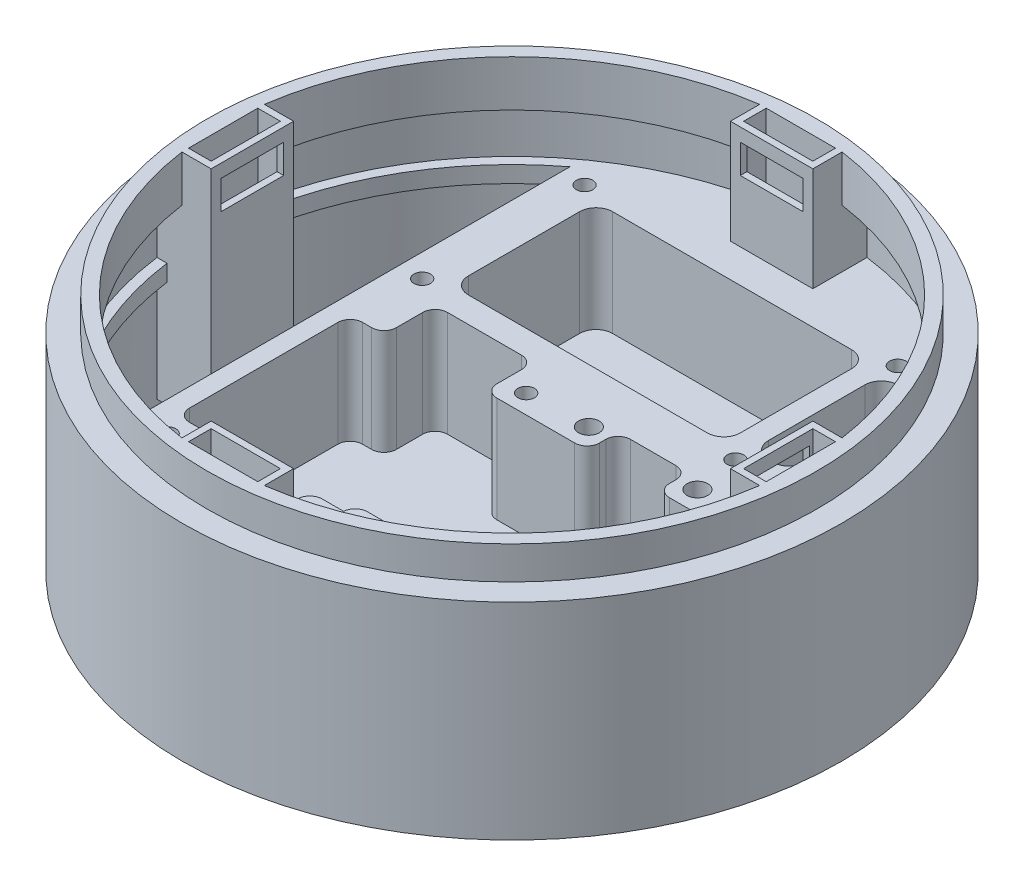
from build123d import *
from build123d.topology import SkipClean

# Parameters (mm, degrees)
SKETCH1_R                 = 40
BOSS_EXTRUDE1_DEPTH       = 25
SKETCH2_R                 = 37
BOSS_EXTRUDE2_DEPTH       = 4
SHELL1_T                  = -1.6
CUT_EXTRUDE2_START        = -5.6
SKETCH4_R                 = 35.4
CUT_EXTRUDE2_DEPTH        = 5.6
BOSS_EXTRUDE3_START       = 2
SKETCH5_R                 = 38.4
BOSS_EXTRUDE3_DEPTH       = 2
SKETCH6_R                 = 1.25
CUT_EXTRUDE3_DEPTH        = 2
SKETCH8_R                 = 1
CUT_EXTRUDE4_DEPTH        = 2
SKETCH9_R                 = 1
SKETCH9_W                 = 33
SKETCH9_H                 = 17.5
CUT_EXTRUDE5_DEPTH        = 2
FILLET4_R                 = 2
CUT_EXTRUDE6_DEPTH        = 2
BOSS_EXTRUDE4_START       = -6.9
BOSS_EXTRUDE4_OUTLINE_W   = 10
BOSS_EXTRUDE4_OUTLINE_H   = 14.4
BOSS_EXTRUDE4_OUTLINE_H_2 = 7
BOSS_EXTRUDE4_DEPTH       = 6.9
BOSS_EXTRUDE4_START_2     = -4.027089231
BOSS_EXTRUDE4_2_OUTLINE_W = 10
BOSS_EXTRUDE4_2_OUTLINE_H = 5.6
BOSS_EXTRUDE4_2_DEPTH     = 4.027089231
SKETCH13_W                = 8.4
SKETCH13_H                = 2.745113782
CUT_EXTRUDE7_DEPTH        = 29
CIRPATTERN3_START         = 14.4
CIRPATTERN3_OUTLINE_W     = 8.4
CIRPATTERN3_OUTLINE_H     = 2.745113782
CIRPATTERN3_DEPTH         = 2
CIRPATTERN3_2_OUTLINE_W   = 8.4
CIRPATTERN3_2_OUTLINE_H   = 2.745113782
CIRPATTERN3_2_OUTLINE_W_2 = 2.745113782
CIRPATTERN3_2_OUTLINE_H_2 = 8.4
CIRPATTERN3_2_DEPTH       = 23.991472
CIRPATTERN3_START_2       = 23.4
CIRPATTERN3_3_OUTLINE_W   = 8.4
CIRPATTERN3_3_OUTLINE_H   = 2.745113782
CIRPATTERN3_3_OUTLINE_W_2 = 2.745113782
CIRPATTERN3_3_OUTLINE_H_2 = 8.4
CIRPATTERN3_3_DEPTH       = 5.6
BOSS_EXTRUDE5_START       = 12.9
BOSS_EXTRUDE5_DEPTH       = 12.9
CUT_EXTRUDE12_DEPTH       = 1.5
CUT_EXTRUDE9_DEPTH        = 1.5
CUT_EXTRUDE14_START       = 1.5
SKETCH22_R                = 38.4
CUT_EXTRUDE14_DEPTH       = 1.5
SKETCH23_R                = 1.25
SKETCH23_R_2              = 1
CUT_EXTRUDE15_DEPTH       = 10.8
CUT_EXTRUDE10_REACH       = 88.909
SKETCH14_W                = 7.6
SKETCH14_H                = 3.5
CUT_EXTRUDE11_REACH       = 88.909
SKETCH18_W                = 7.6
SKETCH18_H                = 3.5
SKETCH24_W                = 34.5
SKETCH24_H                = 44
BOSS_EXTRUDE6_DEPTH       = 0.75
CHAMFER1_SIZE             = 0.75
CUT_EXTRUDE20_START       = -14.9
CUT_EXTRUDE20_DEPTH       = 14.9
CUT_EXTRUDE21_DEPTH       = 12.8
SKETCH33_W                = 19.8
SKETCH33_H                = 12.8
CUT_EXTRUDE22_DEPTH       = 28.191583709
FILLET6_R                 = 1.5


with BuildPart() as part:
    # Sketch1 → Boss-Extrude1 (new body)
    with BuildSketch(Plane(origin=(0, 0, 0), x_dir=(1, 0, 0), z_dir=(0, 1, 0))):
        with Locations(Location((0, 0, 0), (0, 0, 270))):
            Circle(SKETCH1_R)
    extrude(amount=BOSS_EXTRUDE1_DEPTH)

    # Sketch2 → Boss-Extrude2 (add)
    with BuildSketch(Plane(origin=(0, 25, 0), x_dir=(1, 0, 0), z_dir=(0, 1, 0))):
        with Locations(Location((0, 0, 0), (0, 0, 270))):
            Circle(SKETCH2_R)
    extrude(amount=BOSS_EXTRUDE2_DEPTH)

    # Shell1
    shell1_openings = [part.faces().sort_by_distance(p)[0] for p in [
        (0, 0, 0),
    ]]
    offset(amount=SHELL1_T, openings=shell1_openings, kind=Kind.INTERSECTION)

    # Sketch4 → Cut-Extrude2 (cut)
    with BuildSketch(Plane(origin=(0, 29, 0), x_dir=(1, 0, 0), z_dir=(0, 1, 0)).offset(CUT_EXTRUDE2_START)):
        with Locations(Location((0, 0, 0), (0, 0, 270))):
            Circle(SKETCH4_R)
    extrude(amount=CUT_EXTRUDE2_DEPTH, mode=Mode.SUBTRACT)

    # Sketch5 → Boss-Extrude3 (add)
    with BuildSketch(Plane(origin=(0, 16.4, 0), x_dir=(-1, 0, 0), z_dir=(0, -1, 0)).offset(BOSS_EXTRUDE3_START)):
        with Locations(Location((0, 0, 0), (0, 0, 90))):
            Circle(SKETCH5_R)
    extrude(amount=-BOSS_EXTRUDE3_DEPTH)

    # Sketch6 → Cut-Extrude3 (cut)
    with BuildSketch(Plane(origin=(0, 16.4, 0), x_dir=(1, 0, 0), z_dir=(0, 1, 0))):
        with Locations(Location((19.09668222, 3.4, 0), (0, 0, 270))):
            Circle(SKETCH6_R)
        with Locations(Location((5.92668222, 3.4, 0), (0, 0, 270))):
            Circle(SKETCH6_R)
        with Locations(Location((20.76668222, -27.4, 0), (0, 0, 270))):
            Circle(SKETCH6_R)
        with Locations(Location((4.25668222, -27.4, 0), (0, 0, 270))):
            Circle(SKETCH6_R)
        Polygon((8.26168222, 0.85), (1.81168222, 0.85), (1.81168222, -18.95), (8.26168222, -18.95), (8.26168222, -28.750015402), (16.76168222, -28.750015402), (16.76168222, -18.95), (23.21168222, -18.95), (23.21168222, 0.85), (16.76168222, 0.85), (16.76168222, 4.615440546), (8.26168222, 4.615440546), align=None)
    extrude(amount=-CUT_EXTRUDE3_DEPTH, mode=Mode.SUBTRACT)

    # Sketch8 → Cut-Extrude4 (cut)
    with BuildSketch(Plane(origin=(0, 16.4, 0), x_dir=(1, 0, 0), z_dir=(0, 1, 0))):
        with Locations(Location((-1.429901488, -22.85, 0), (0, 0, 270))):
            Circle(SKETCH8_R)
        with Locations(Location((-18.929901488, -22.85, 0), (0, 0, 270))):
            Circle(SKETCH8_R)
        with Locations(Location((-1.429901488, 3.15, 0), (0, 0, 270))):
            Circle(SKETCH8_R)
        Polygon((-16.179901488, -24.35), (-16.179901488, -20.35), (-20.279901488, -20.35), (-20.279901488, 0.65), (-16.179901488, 0.65), (-16.179901488, 6.85), (-4.179901488, 6.85), (-4.179901488, 0.65), (-0.079901488, 0.65), (-0.079901488, -20.35), (-4.179901488, -20.35), (-4.179901488, -24.35), align=None)
    extrude(amount=-CUT_EXTRUDE4_DEPTH, mode=Mode.SUBTRACT)

    # Sketch9 → Cut-Extrude5 (cut)
    with BuildSketch(Plane(origin=(0, 16.4, 0), x_dir=(1, 0, 0), z_dir=(0, 1, 0))):
        with Locations(Location((18.25, 28.55, 0), (0, 0, 270))):
            Circle(SKETCH9_R)
        with Locations(Location((-19.75, 28.55, 0), (0, 0, 90))):
            Circle(SKETCH9_R)
        with Locations(Location((18.25, 8.85, 0), (0, 0, 90))):
            Circle(SKETCH9_R)
        with Locations(Location((-19.75, 8.85, 0), (0, 0, 270))):
            Circle(SKETCH9_R)
        with Locations((-0.75, 18.7)):
            Rectangle(SKETCH9_W, SKETCH9_H)
    extrude(amount=-CUT_EXTRUDE5_DEPTH, mode=Mode.SUBTRACT)

    # Fillet4
    fillet4_edges = [part.edges().sort_by_distance(p)[0] for p in [
        (-17.25, 15.4, -9.95),
        (15.75, 15.4, -9.95),
        (15.75, 15.4, -27.45),
        (-17.25, 15.4, -27.45),
    ]]
    fillet(fillet4_edges, radius=FILLET4_R)

    # Sketch11 → Cut-Extrude6 (cut)
    with BuildSketch(Plane(origin=(0, 16.4, 0), x_dir=(1, 0, 0), z_dir=(0, 1, 0))):
        with BuildLine():
            Line((24.01168222, -28.412657689), (24.01168222, 28.412657689))
            ThreePointArc((24.01168222, 28.412657689), (37.2, 0), (24.01168222, -28.412657689))
        make_face()
        with BuildLine():
            Line((-22.55, -29.586103157), (-22.55, 29.586103157))
            ThreePointArc((-22.55, 29.586103157), (-37.2, 0), (-22.55, -29.586103157))
        make_face()
    extrude(amount=-CUT_EXTRUDE6_DEPTH, mode=Mode.SUBTRACT)

    # Boss-Extrude4: read off the stored shape, not the designer's step
    # Boss-Extrude4 outline → Boss-Extrude4 (add)
    with BuildSketch(Plane.XY.offset(-31.5).offset(BOSS_EXTRUDE4_START)):
        with Locations((0, 7.2)):
            Rectangle(BOSS_EXTRUDE4_OUTLINE_W, BOSS_EXTRUDE4_OUTLINE_H)
        with Locations((0, 19.9)):
            Rectangle(BOSS_EXTRUDE4_OUTLINE_W, BOSS_EXTRUDE4_OUTLINE_H_2)
    extrude(amount=BOSS_EXTRUDE4_DEPTH)

    # Boss-Extrude4 2 outline → Boss-Extrude4 2 (add)
    with BuildSketch(Plane.XY.offset(-31.5).offset(BOSS_EXTRUDE4_START_2)):
        with Locations((0, 26.2)):
            Rectangle(BOSS_EXTRUDE4_2_OUTLINE_W, BOSS_EXTRUDE4_2_OUTLINE_H)
    extrude(amount=BOSS_EXTRUDE4_2_DEPTH)

    # Sketch13 → Cut-Extrude7 (cut)
    with BuildSketch(Plane(origin=(0, 29, 0), x_dir=(1, 0, 0), z_dir=(0, 1, 0))):
        with Locations((0, 33.672556891)):
            Rectangle(SKETCH13_W, SKETCH13_H)
    extrude(amount=-CUT_EXTRUDE7_DEPTH, mode=Mode.SUBTRACT)

    # CirPattern3: read off the stored shape, not the designer's step
    # CirPattern3 outline → CirPattern3 (cut)
    with BuildSketch(Plane(origin=(0, 0, 0), x_dir=(1, 0, 0), z_dir=(0, 1, 0)).offset(CIRPATTERN3_START)):
        with Locations((0, -33.672556891)):
            Rectangle(CIRPATTERN3_OUTLINE_W, CIRPATTERN3_OUTLINE_H)
    extrude(amount=CIRPATTERN3_DEPTH, mode=Mode.SUBTRACT)

    # CirPattern3 2 outline → CirPattern3 2 (add)
    # profile 1 of 3: a face of its own
    with BuildSketch(Plane(origin=(0, 0, 0), x_dir=(1, 0, 0), z_dir=(0, 1, 0))):
        with BuildLine():
            Line((5, -31.5), (-5, -31.5))
            Line((-5, -31.5), (-5, -38.073087608))
            ThreePointArc((-5, -38.073087608), (0, -38.4), (5, -38.073087608))
            Line((5, -38.073087608), (5, -31.5))
        make_face()
        with Locations((0, -33.672556891)):
            Rectangle(CIRPATTERN3_2_OUTLINE_W, CIRPATTERN3_2_OUTLINE_H, mode=Mode.SUBTRACT)
    # profile 2 of 3: a face of its own
    with BuildSketch(Plane(origin=(0, 0, 0), x_dir=(1, 0, 0), z_dir=(0, 1, 0))):
        with BuildLine():
            Line((-31.5, 5), (-38.073087608, 5))
            ThreePointArc((-38.073087608, 5), (-38.4, 0), (-38.073087608, -5))
            Line((-38.073087608, -5), (-31.5, -5))
            Line((-31.5, -5), (-31.5, 5))
        make_face()
        with Locations((-33.672556891, 0)):
            Rectangle(CIRPATTERN3_2_OUTLINE_W_2, CIRPATTERN3_2_OUTLINE_H_2, mode=Mode.SUBTRACT)
    # profile 3 of 3: a face of its own
    with BuildSketch(Plane(origin=(0, 0, 0), x_dir=(1, 0, 0), z_dir=(0, 1, 0))):
        with BuildLine():
            Line((31.5, 5), (31.5, -5))
            Line((31.5, -5), (38.073087608, -5))
            ThreePointArc((38.073087608, -5), (38.4, 0), (38.073087608, 5))
            Line((38.073087608, 5), (31.5, 5))
        make_face()
        with Locations((33.672556891, 0)):
            Rectangle(CIRPATTERN3_2_OUTLINE_W_2, CIRPATTERN3_2_OUTLINE_H_2, mode=Mode.SUBTRACT)
    extrude(amount=CIRPATTERN3_2_DEPTH)

    # CirPattern3 3 outline → CirPattern3 3 (add)
    # profile 1 of 3: a face of its own
    with BuildSketch(Plane(origin=(0, 0, 0), x_dir=(1, 0, 0), z_dir=(0, 1, 0)).offset(CIRPATTERN3_START_2)):
        with BuildLine():
            Line((5, -31.5), (-5, -31.5))
            Line((-5, -31.5), (-5, -35.045113782))
            ThreePointArc((-5, -35.045113782), (0, -35.4), (5, -35.045113782))
            Line((5, -35.045113782), (5, -31.5))
        make_face()
        with Locations((0, -33.672556891)):
            Rectangle(CIRPATTERN3_3_OUTLINE_W, CIRPATTERN3_3_OUTLINE_H, mode=Mode.SUBTRACT)
    # profile 2 of 3: a face of its own
    with BuildSketch(Plane(origin=(0, 0, 0), x_dir=(1, 0, 0), z_dir=(0, 1, 0)).offset(CIRPATTERN3_START_2)):
        with BuildLine():
            ThreePointArc((-35.045113782, 5), (-35.4, 0), (-35.045113782, -5))
            Line((-35.045113782, -5), (-31.5, -5))
            Line((-31.5, -5), (-31.5, 5))
            Line((-31.5, 5), (-35.045113782, 5))
        make_face()
        with Locations((-33.672556891, 0)):
            Rectangle(CIRPATTERN3_3_OUTLINE_W_2, CIRPATTERN3_3_OUTLINE_H_2, mode=Mode.SUBTRACT)
    # profile 3 of 3: a face of its own
    with BuildSketch(Plane(origin=(0, 0, 0), x_dir=(1, 0, 0), z_dir=(0, 1, 0)).offset(CIRPATTERN3_START_2)):
        with BuildLine():
            Line((31.5, -5), (35.045113782, -5))
            ThreePointArc((35.045113782, -5), (35.4, 0), (35.045113782, 5))
            Line((35.045113782, 5), (31.5, 5))
            Line((31.5, 5), (31.5, -5))
        make_face()
        with Locations((33.672556891, 0)):
            Rectangle(CIRPATTERN3_3_OUTLINE_W_2, CIRPATTERN3_3_OUTLINE_H_2, mode=Mode.SUBTRACT)
    extrude(amount=CIRPATTERN3_3_DEPTH)

    # Sketch16 → Boss-Extrude5 (add)
    with BuildSketch(Plane.XZ.offset(-14.4).offset(BOSS_EXTRUDE5_START)):
        with BuildLine():
            Line((-5, -38.073087608), (-5, -31.5))
            Line((-5, -31.5), (5, -31.5))
            Line((5, -31.5), (5, -38.073087608))
            ThreePointArc((5, -38.073087608), (15.061476564, -35.322965953), (24.01168222, -29.966633394))
            Line((24.01168222, -29.966633394), (24.01168222, 29.966633394))
            ThreePointArc((24.01168222, 29.966633394), (15.061476564, 35.322965953), (5, 38.073087608))
            Line((5, 38.073087608), (5, 31.5))
            Line((5, 31.5), (-5, 31.5))
            Line((-5, 31.5), (-5, 38.073087608))
            ThreePointArc((-5, 38.073087608), (-14.211661402, 35.673360932), (-22.55, 31.081465538))
            Line((-22.55, 31.081465538), (-22.55, -31.081465538))
            ThreePointArc((-22.55, -31.081465538), (-14.211661402, -35.673360932), (-5, -38.073087608))
        make_face()
    extrude(amount=-BOSS_EXTRUDE5_DEPTH)

    # Sketch19 → Cut-Extrude12 (cut)
    with BuildSketch(Plane.XZ):
        with BuildLine():
            Line((5, 38.073087608), (5, 31.5))
            Line((5, 31.5), (-5, 31.5))
            Line((-5, 31.5), (-5, 38.073087608))
            ThreePointArc((-5, 38.073087608), (0, 38.4), (5, 38.073087608))
        make_face()
    extrude(amount=-CUT_EXTRUDE12_DEPTH, mode=Mode.SUBTRACT)

    # Sketch15 → Cut-Extrude9 (cut)
    with BuildSketch(Plane(origin=(0, 1.5, 0), x_dir=(-1, 0, 0), z_dir=(0, -1, 0))):
        with BuildLine():
            Line((-17.25, 25.192602838), (-17.25, -34.307397162))
            ThreePointArc((-17.25, -34.307397162), (0, -38.4), (17.25, -34.307397162))
            Line((17.25, -34.307397162), (17.25, 25.192602838))
            Line((17.25, 25.192602838), (-17.25, 25.192602838))
        make_face()
    extrude(amount=-CUT_EXTRUDE9_DEPTH, mode=Mode.SUBTRACT)

    # Sketch22 → Cut-Extrude14 (cut)
    with SkipClean():  # the faces are left unmerged after this step: merging them gives an invalid solid
        with BuildSketch(Plane(origin=(0, 1.5, 0), x_dir=(-1, 0, 0), z_dir=(0, -1, 0)).offset(CUT_EXTRUDE14_START)):
            with Locations(Location((0, 0, 0), (0, 0, 54.038635621))):
                Circle(SKETCH22_R)
        extrude(amount=-CUT_EXTRUDE14_DEPTH, mode=Mode.SUBTRACT)
    add(part.part.scale(1), mode=Mode.REPLACE)  # the faces are merged on a copy

    # Sketch23 → Cut-Extrude15 (cut)
    with BuildSketch(Plane(origin=(0, 14.4, 0), x_dir=(1, 0, 0), z_dir=(0, 1, 0))):
        with Locations(Location((5.92668222, 3.4, 0), (0, 0, 270))):
            Circle(SKETCH23_R)
        with Locations(Location((-19.75, 8.85, 0), (0, 0, 270))):
            Circle(SKETCH23_R_2)
        with Locations(Location((-19.75, 28.55, 0), (0, 0, 90))):
            Circle(SKETCH23_R_2)
        with Locations(Location((18.25, 28.55, 0), (0, 0, 270))):
            Circle(SKETCH23_R_2)
        with Locations(Location((18.25, 8.85, 0), (0, 0, 90))):
            Circle(SKETCH23_R_2)
        with Locations(Location((-1.429901488, 3.15, 0), (0, 0, 270))):
            Circle(SKETCH23_R_2)
        with Locations(Location((19.09668222, 3.4, 0), (0, 0, 270))):
            Circle(SKETCH23_R)
        with Locations(Location((-18.929901488, -22.85, 0), (0, 0, 270))):
            Circle(SKETCH23_R_2)
        with Locations(Location((-1.429901488, -22.85, 0), (0, 0, 270))):
            Circle(SKETCH23_R_2)
        with Locations(Location((20.76668222, -27.4, 0), (0, 0, 270))):
            Circle(SKETCH23_R)
        with Locations(Location((4.25668222, -27.4, 0), (0, 0, 270))):
            Circle(SKETCH23_R)
        Polygon((23.21168222, 0.85), (16.76168222, 0.85), (16.76168222, 4.615440546), (8.26168222, 4.615440546), (8.26168222, 0.85), (1.81168222, 0.85), (1.81168222, -18.95), (8.26168222, -18.95), (8.26168222, -28.750015402), (16.76168222, -28.750015402), (16.76168222, -18.95), (23.21168222, -18.95), align=None)
        Polygon((-16.179901488, 0.65), (-20.279901488, 0.65), (-20.279901488, -20.35), (-16.179901488, -20.35), (-16.179901488, -24.35), (-4.179901488, -24.35), (-4.179901488, -20.35), (-0.079901488, -20.35), (-0.079901488, 0.65), (-4.179901488, 0.65), (-4.179901488, 6.85), (-16.179901488, 6.85), align=None)
        with BuildLine():
            Line((13.75, 27.45), (-15.25, 27.45))
            ThreePointArc((-15.25, 27.45), (-16.664213562, 26.864213562), (-17.25, 25.45))
            Line((-17.25, 25.45), (-17.25, 11.95))
            ThreePointArc((-17.25, 11.95), (-16.664213562, 10.535786438), (-15.25, 9.95))
            Line((-15.25, 9.95), (13.75, 9.95))
            ThreePointArc((13.75, 9.95), (15.164213562, 10.535786438), (15.75, 11.95))
            Line((15.75, 11.95), (15.75, 25.45))
            ThreePointArc((15.75, 25.45), (15.164213562, 26.864213562), (13.75, 27.45))
        make_face()
    extrude(amount=-CUT_EXTRUDE15_DEPTH, mode=Mode.SUBTRACT)

    # Sketch14 → Cut-Extrude10 (cut, up to next)
    with BuildSketch(Plane.XY.offset(-31.5), mode=Mode.PRIVATE) as cut_extrude10_sk1:
        with Locations((0, 25.65)):
            Rectangle(SKETCH14_W, SKETCH14_H)
    cut_extrude10_tool1 = extrude(cut_extrude10_sk1.sketch, amount=-CUT_EXTRUDE10_REACH, mode=Mode.PRIVATE) & part.part
    add(cut_extrude10_tool1.solids().sort_by_distance((0, 25.65, -31.5))[0], mode=Mode.SUBTRACT)

    # Sketch18 → Cut-Extrude11 (cut, up to next)
    with BuildSketch(Plane(origin=(31.5, 0, 0), x_dir=(0, 0, -1), z_dir=(1, 0, 0)), mode=Mode.PRIVATE) as cut_extrude11_sk1:
        with Locations((0, 25.65)):
            Rectangle(SKETCH18_W, SKETCH18_H)
    cut_extrude11_tool1 = extrude(cut_extrude11_sk1.sketch, amount=CUT_EXTRUDE11_REACH, mode=Mode.PRIVATE) & part.part
    cut_extrude11 = cut_extrude11_tool1.solids().sort_by_distance((31.5, 25.65, 0))[0]
    add(cut_extrude11, mode=Mode.SUBTRACT)

    # Mirror3: Cut-Extrude11 across plane
    add(cut_extrude11.mirror(Plane(origin=(0, 0, 0), x_dir=(0, 0, 1), z_dir=(1, 0, 0))), mode=Mode.SUBTRACT)

    # Sketch24 → Boss-Extrude6 (add)
    with BuildSketch(Plane.XZ.offset(-3)):
        with Locations((0, -3.192602838)):
            Rectangle(SKETCH24_W, SKETCH24_H)
    extrude(amount=BOSS_EXTRUDE6_DEPTH)

    # Chamfer1
    chamfer1_edges = [part.edges().sort_by_distance(p)[0] for p in [
        (0, 2.25, 18.807397162),
    ]]
    chamfer(chamfer1_edges, length=CHAMFER1_SIZE - 0.0001)  # a hair under: the kernel refuses the full size

    # Sketch30 → Cut-Extrude20 (cut)
    with BuildSketch(Plane(origin=(0, 16.4, 0), x_dir=(1, 0, 0), z_dir=(0, 1, 0)).offset(CUT_EXTRUDE20_START)):
        with BuildLine():
            Line((0.920098512, -32.15), (17.25, -32.15))
            Line((17.25, -32.15), (17.25, -34.307397162))
            ThreePointArc((17.25, -34.307397162), (0, -38.4), (-17.25, -34.307397162))
            Line((-17.25, -34.307397162), (-17.25, -32.15))
            Line((-17.25, -32.15), (0.920098512, -32.15))
        make_face()
    extrude(amount=CUT_EXTRUDE20_DEPTH, mode=Mode.SUBTRACT)

    # Sketch31 → Cut-Extrude21 (cut)
    with SkipClean():  # the faces are left unmerged after this step: merging them gives an invalid solid
        with BuildSketch(Plane(origin=(0, 16.4, 0), x_dir=(1, 0, 0), z_dir=(0, 1, 0))):
            with BuildLine():
                Line((20.81168222, 10.85), (20.25, 10.85))
                ThreePointArc((20.25, 10.85), (18.835786438, 11.435786438), (18.25, 12.85))
                Line((18.25, 12.85), (18.25, 24.55))
                ThreePointArc((18.25, 24.55), (18.835786438, 25.964213562), (20.25, 26.55))
                Line((20.25, 26.55), (20.81168222, 26.55))
                ThreePointArc((20.81168222, 26.55), (22.225895783, 25.964213562), (22.81168222, 24.55))
                Line((22.81168222, 24.55), (22.81168222, 12.85))
                ThreePointArc((22.81168222, 12.85), (22.225895783, 11.435786438), (20.81168222, 10.85))
            make_face()
        extrude(amount=-CUT_EXTRUDE21_DEPTH, mode=Mode.SUBTRACT)

    # Sketch33 → Cut-Extrude22 (cut)
    with SkipClean():  # the faces are left unmerged after this step: merging them gives an invalid solid
        with BuildSketch(Plane(origin=(24.01168222, 0, 0), x_dir=(0, 0, -1), z_dir=(1, 0, 0))):
            with Locations((-9.05, 10)):
                Rectangle(SKETCH33_W, SKETCH33_H)
        extrude(amount=-CUT_EXTRUDE22_DEPTH, mode=Mode.SUBTRACT)

    # Fillet6
    # the kernel refuses this fillet: 1.5 mm, written as the material it adds along each edge
    with BuildSketch(Plane(origin=(-4.179901488, 3.6, -6.85), x_dir=(-1, 0, 0), z_dir=(0, 1, 0)), Plane(origin=(-16.179901488, 3.6, -6.85), x_dir=(0, 0, 1), z_dir=(0, 1, 0)), Plane(origin=(-20.279901488, 3.6, -0.65), x_dir=(0, 0, 1), z_dir=(0, 1, 0)), Plane(origin=(-20.279901488, 3.6, 20.35), x_dir=(1, 0, 0), z_dir=(0, 1, 0)), Plane(origin=(16.76168222, 3.6, -4.615440546), x_dir=(-1, 0, 0), z_dir=(0, 1, 0)), Plane(origin=(8.26168222, 3.6, -4.615440546), x_dir=(0, 0, 1), z_dir=(0, 1, 0))) as fillet6_piece_1:
        with BuildLine():
            CenterArc((FILLET6_R, FILLET6_R), FILLET6_R, 180, 90)
            Line((0, FILLET6_R), (0, 0))
            Line((0, 0), (FILLET6_R, 0))
        make_face()
    extrude(amount=12.8)
    with BuildSketch(Plane(origin=(-16.179901488, 16.4, 24.35), x_dir=(1, 0, 0), z_dir=(0, -1, 0)), Plane(origin=(-4.179901488, 16.4, 24.35), x_dir=(0, 0, -1), z_dir=(0, -1, 0)), Plane(origin=(8.26168222, 16.4, 28.750015402), x_dir=(1, 0, 0), z_dir=(0, -1, 0)), Plane(origin=(16.76168222, 16.4, 28.750015402), x_dir=(0, 0, -1), z_dir=(0, -1, 0))) as fillet6_piece_2:
        with BuildLine():
            CenterArc((FILLET6_R, -FILLET6_R), FILLET6_R, 90, 90)
            Line((0, -FILLET6_R), (0, 0))
            Line((0, 0), (FILLET6_R, 0))
        make_face()
    extrude(amount=12.8)
    # the kernel refuses this fillet: 1.5 mm, written as the material it takes off along each edge
    with BuildSketch(Plane(origin=(-4.179901488, 20.15, 20.35), x_dir=(1, 0, 0), z_dir=(0, -1, 0)), Plane(origin=(8.26168222, 20.15, -0.85), x_dir=(-1, 0, 0), z_dir=(0, -1, 0)), Plane(origin=(8.26168222, 20.15, 18.95), x_dir=(0, 0, 1), z_dir=(0, -1, 0))) as fillet6_2_piece_1:
        with BuildLine():
            CenterArc((FILLET6_R, FILLET6_R), FILLET6_R, 180, 90)
            Line((0, FILLET6_R), (0, 0))
            Line((0, 0), (FILLET6_R, 0))
        make_face()
    extrude(amount=16.55, mode=Mode.SUBTRACT)
    with BuildSketch(Plane(origin=(-16.179901488, 3.6, -0.65), x_dir=(-1, 0, 0), z_dir=(0, 1, 0)), Plane(origin=(-16.179901488, 3.6, 20.35), x_dir=(0, 0, 1), z_dir=(0, 1, 0)), Plane(origin=(16.76168222, 3.6, -0.85), x_dir=(0, 0, -1), z_dir=(0, 1, 0)), Plane(origin=(16.76168222, 3.6, 18.95), x_dir=(1, 0, 0), z_dir=(0, 1, 0))) as fillet6_2_piece_2:
        with BuildLine():
            CenterArc((FILLET6_R, -FILLET6_R), FILLET6_R, 90, 90)
            Line((0, -FILLET6_R), (0, 0))
            Line((0, 0), (FILLET6_R, 0))
        make_face()
    extrude(amount=16.55, mode=Mode.SUBTRACT)
    with BuildSketch(Plane(origin=(-4.179901489, 3.6, -0.85), x_dir=(2.337176378356769e-10, 0, -1.0), z_dir=(0, 1, 0))) as fillet6_2_piece_3:
        with BuildLine():
            CenterArc((FILLET6_R, -FILLET6_R), FILLET6_R, 90.000000013, 90)
            Line((FILLET6_R * 2.33717415846e-10, -FILLET6_R), (0, 0))
            Line((0, 0), (FILLET6_R, 0))
        make_face()
    extrude(amount=16.550000001, mode=Mode.SUBTRACT)
    with BuildSketch(Plane(origin=(-0.079901488, 3.6, 18.95), x_dir=(1, 0, 0), z_dir=(0, 1, 0))) as fillet6_2_piece_4:
        with BuildLine():
            CenterArc((1.496662955, -1.5), FILLET6_R, 90, 86.177446271)
            Line((0, -1.4), (0, 0))
            Line((0, 0), (1.496662955, 0))
        make_face()
    extrude(amount=16.541657387, mode=Mode.SUBTRACT)


solid = part.part
